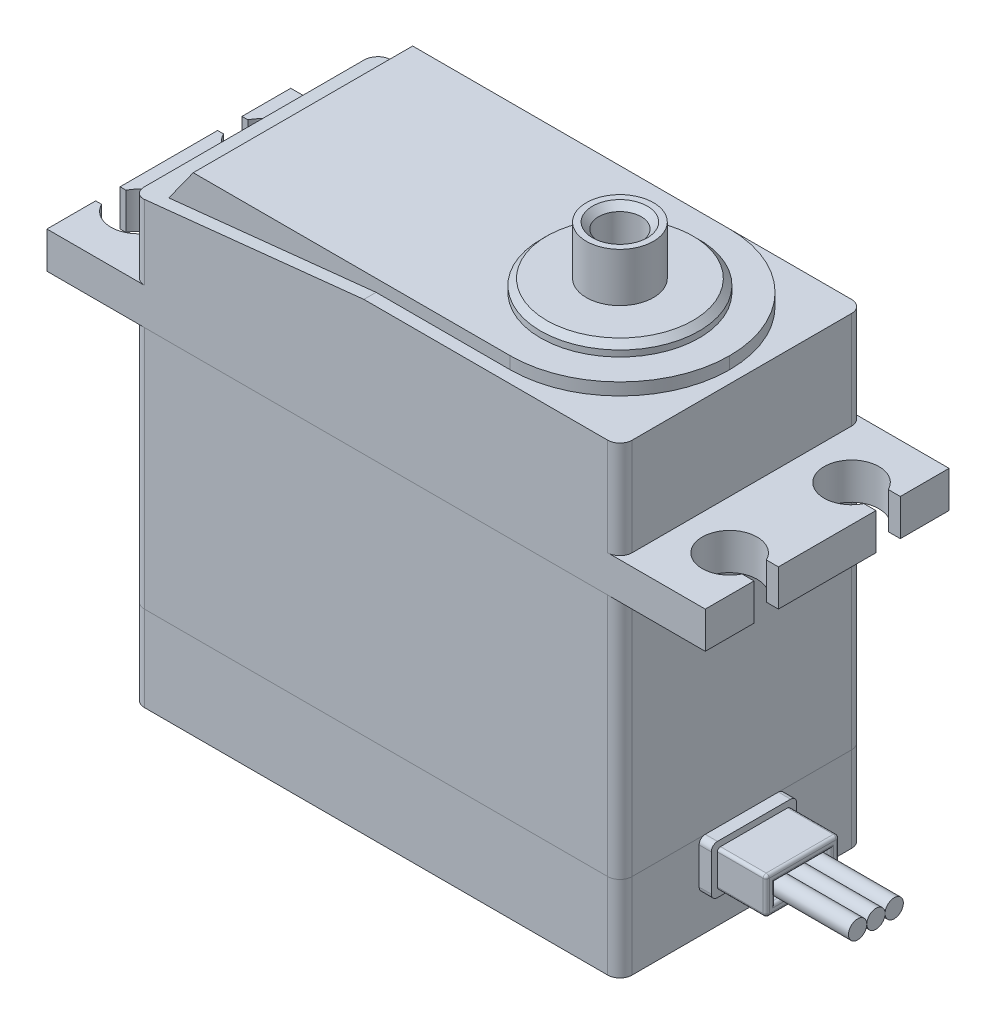
from build123d import *

# Parameters (mm, degrees)
SKETCH1_W            = 40
SKETCH1_H            = 20
BOSS_EXTRUDE1_DEPTH  = 7
SKETCH2_W            = 40
SKETCH2_H            = 20
BOSS_EXTRUDE2_DEPTH  = 20
BOSS_EXTRUDE3_DEPTH  = 20
BOSS_EXTRUDE4_DEPTH  = 9
SKETCH5_R            = 6.5
BOSS_EXTRUDE5_DEPTH  = 1
CHAMFER1_SIZE        = 0.5
FILLET1_R            = 9
FILLET2_R            = 1
FILLET3_R            = 1
FILLET4_R            = 1
CUT_EXTRUDE1_DEPTH   = 3
SKETCH7_R            = 2.75
SKETCH7_R_2          = 1.75
BOSS_EXTRUDE6_DEPTH  = 4
CHAMFER2_SIZE        = 0.5
SKETCH8_W            = 7
SKETCH8_H            = 4
BOSS_EXTRUDE7_DEPTH  = 1
SKETCH9_W            = 6
SKETCH9_H            = 3
BOSS_EXTRUDE8_DEPTH  = 4
SKETCH10_W           = 4.5
SKETCH10_H           = 1.5
CUT_EXTRUDE2_DEPTH   = 4
SKETCH11_R           = 0.75
BOSS_EXTRUDE9_DEPTH  = 10
SKETCH12_R           = 0.75
BOSS_EXTRUDE10_DEPTH = 10
SKETCH13_R           = 0.75
BOSS_EXTRUDE11_DEPTH = 10
FILLET5_R            = 0.5
FILLET6_R            = 0.25
FILLET7_R            = 0.25


with BuildPart() as part:
    # Sketch1 → Boss-Extrude1 (new body)
    with BuildSketch(Plane(origin=(0, 0, 0), x_dir=(1, 0, 0), z_dir=(0, 1, 0))):
        Rectangle(SKETCH1_W, SKETCH1_H)
    extrude(amount=BOSS_EXTRUDE1_DEPTH)

    # Fillet2
    fillet2_edges = [part.edges().sort_by_distance(p)[0] for p in [
        (-20, 3.5, -10),
        (20, 3.5, -10),
        (20, 3.5, 10),
        (-20, 3.5, 10),
    ]]
    fillet(fillet2_edges, radius=FILLET2_R)


with BuildPart() as body_2:
    # Sketch2 → Boss-Extrude2 (new body)
    with BuildSketch(Plane(origin=(0, 7, 0), x_dir=(1, 0, 0), z_dir=(0, 1, 0))):
        Rectangle(SKETCH2_W, SKETCH2_H)
    extrude(amount=BOSS_EXTRUDE2_DEPTH)

    # Fillet3
    fillet3_edges = [body_2.edges().sort_by_distance(p)[0] for p in [
        (-20, 17, -10),
        (20, 17, -10),
        (20, 17, 10),
        (-20, 17, 10),
    ]]
    fillet(fillet3_edges, radius=FILLET3_R)


with BuildPart() as body_3:
    # Sketch3 → Boss-Extrude3 (new body)
    with BuildSketch(Plane.XY.offset(10)):
        Polygon((-27, 27), (27, 27), (27, 30), (20, 30), (20, 38), (-1, 38), (-20, 36), (-20, 30), (-27, 30), align=None)
    extrude(amount=-BOSS_EXTRUDE3_DEPTH)

    # Sketch4 → Boss-Extrude4 (add, symmetric)
    with BuildSketch(Plane.XY):
        Polygon((-18, 36.210526316), (-16, 39), (19, 39), (19, 38), (-1, 38), align=None)
    extrude(amount=BOSS_EXTRUDE4_DEPTH, both=True)

    # Sketch5 → Boss-Extrude5 (add)
    with BuildSketch(Plane(origin=(0, 39, 0), x_dir=(1, 0, 0), z_dir=(0, 1, 0))):
        with Locations(Location((10, 0, 0), (0, 0, 270))):
            Circle(SKETCH5_R)
    extrude(amount=BOSS_EXTRUDE5_DEPTH)

    # Chamfer1
    chamfer1_edges = [body_3.edges().sort_by_distance(p)[0] for p in [
        (10, 40, -6.5),
    ]]
    chamfer(chamfer1_edges, length=CHAMFER1_SIZE)

    # Fillet1
    fillet1_edges = [body_3.edges().sort_by_distance(p)[0] for p in [
        (19, 38.5, -9),
        (19, 38.5, 9),
    ]]
    fillet(fillet1_edges, radius=FILLET1_R - 0.0001)  # a hair under: the kernel refuses the full size

    # Fillet4
    fillet4_edges = [body_3.edges().sort_by_distance(p)[0] for p in [
        (20, 34, 10),
        (20, 34, -10),
        (-20, 33, -10),
        (-20, 33, 10),
    ]]
    fillet(fillet4_edges, radius=FILLET4_R)

    # Sketch6 → Cut-Extrude1 (cut)
    with BuildSketch(Plane(origin=(0, 30, 0), x_dir=(1, 0, 0), z_dir=(0, 1, 0))):
        with BuildLine():
            Line((-27, 6), (-26.515564437, 6))
            ThreePointArc((-26.515564437, 6), (-22.25, 5), (-26.515564437, 4))
            Line((-26.515564437, 4), (-27, 4))
            Line((-27, 4), (-27, 6))
        make_face()
        with BuildLine():
            Line((-26.515564437, -4), (-27, -4))
            Line((-27, -4), (-27, -6))
            Line((-27, -6), (-26.515564437, -6))
            ThreePointArc((-26.515564437, -6), (-22.25, -5), (-26.515564437, -4))
        make_face()
        with BuildLine():
            Line((26.015564437, 6), (27, 6))
            Line((27, 6), (27, 4))
            Line((27, 4), (26.015564437, 4))
            ThreePointArc((26.015564437, 4), (21.75, 5), (26.015564437, 6))
        make_face()
        with BuildLine():
            Line((26.015564437, -4), (27, -4))
            Line((27, -4), (27, -6))
            Line((27, -6), (26.015564437, -6))
            ThreePointArc((26.015564437, -6), (21.75, -5), (26.015564437, -4))
        make_face()
    extrude(amount=-CUT_EXTRUDE1_DEPTH, mode=Mode.SUBTRACT)


with BuildPart() as body_4:
    # Sketch7 → Boss-Extrude6 (new body)
    with BuildSketch(Plane(origin=(0, 40, 0), x_dir=(1, 0, 0), z_dir=(0, 1, 0))):
        with Locations(Location((10, 0, 0), (0, 0, 270))):
            Circle(SKETCH7_R)
        with Locations(Location((10, 0, 0), (0, 0, 270))):
            Circle(SKETCH7_R_2, mode=Mode.SUBTRACT)
    extrude(amount=BOSS_EXTRUDE6_DEPTH)

    # Chamfer2
    chamfer2_edges = [body_4.edges().sort_by_distance(p)[0] for p in [
        (10, 44, -1.75),
    ]]
    chamfer(chamfer2_edges, length=CHAMFER2_SIZE)


with BuildPart() as body_5:
    # Sketch8 → Boss-Extrude7 (new body)
    with BuildSketch(Plane(origin=(20, 0, 0), x_dir=(0, 0, -1), z_dir=(1, 0, 0))):
        with Locations((0, 5)):
            Rectangle(SKETCH8_W, SKETCH8_H)
    extrude(amount=BOSS_EXTRUDE7_DEPTH)

    # Sketch9 → Boss-Extrude8 (add)
    with BuildSketch(Plane(origin=(21, 0, 0), x_dir=(0, 0, -1), z_dir=(1, 0, 0))):
        with Locations((0, 5)):
            Rectangle(SKETCH9_W, SKETCH9_H)
    extrude(amount=BOSS_EXTRUDE8_DEPTH)

    # Sketch10 → Cut-Extrude2 (cut)
    with BuildSketch(Plane(origin=(25, 0, 0), x_dir=(0, 0, -1), z_dir=(1, 0, 0))):
        with Locations((0, 5)):
            Rectangle(SKETCH10_W, SKETCH10_H)
    extrude(amount=-CUT_EXTRUDE2_DEPTH, mode=Mode.SUBTRACT)

    # Fillet5
    fillet5_edges = [body_5.edges().sort_by_distance(p)[0] for p in [
        (20.5, 7, 3.5),
        (20.5, 7, -3.5),
        (20.5, 3, -3.5),
        (20.5, 3, 3.5),
    ]]
    fillet(fillet5_edges, radius=FILLET5_R)

    # Fillet6
    fillet6_edges = [body_5.edges().sort_by_distance(p)[0] for p in [
        (23, 6.5, 3),
        (23, 3.5, 3),
        (23, 3.5, -3),
        (23, 6.5, -3),
    ]]
    fillet(fillet6_edges, radius=FILLET6_R)

    # Fillet7
    fillet7_edges = [body_5.edges().sort_by_distance(p)[0] for p in [
        (25, 5, 2.25),
        (25, 4.25, 0),
        (25, 5, -2.25),
        (25, 5.75, 0),
        (25, 5, 3),
        (25, 6.5, 0),
        (25, 3.5, 0),
        (25, 5, -3),
        (25, 3.573223305, 2.926776695),
        (25, 3.573223305, -2.926776695),
        (25, 6.426776695, -2.926776695),
        (25, 6.426776695, 2.926776695),
    ]]
    fillet(fillet7_edges, radius=FILLET7_R)


with BuildPart() as body_6:
    # Sketch11 → Boss-Extrude9 (new body)
    with BuildSketch(Plane(origin=(21, 0, 0), x_dir=(0, 0, -1), z_dir=(1, 0, 0))):
        with Locations((0, 5)):
            Circle(SKETCH11_R)
    extrude(amount=BOSS_EXTRUDE9_DEPTH)


with BuildPart() as body_7:
    # Sketch12 → Boss-Extrude10 (new body)
    with BuildSketch(Plane(origin=(21, 0, 0), x_dir=(0, 0, -1), z_dir=(1, 0, 0))):
        with Locations((1.5, 5)):
            Circle(SKETCH12_R)
    extrude(amount=BOSS_EXTRUDE10_DEPTH)


with BuildPart() as body_8:
    # Sketch13 → Boss-Extrude11 (new body)
    with BuildSketch(Plane(origin=(21, 0, 0), x_dir=(0, 0, -1), z_dir=(1, 0, 0))):
        with Locations((-1.5, 5)):
            Circle(SKETCH13_R)
    extrude(amount=BOSS_EXTRUDE11_DEPTH)


solid = Compound([part.part, body_2.part, body_3.part, body_4.part, body_5.part, body_6.part, body_7.part, body_8.part])
